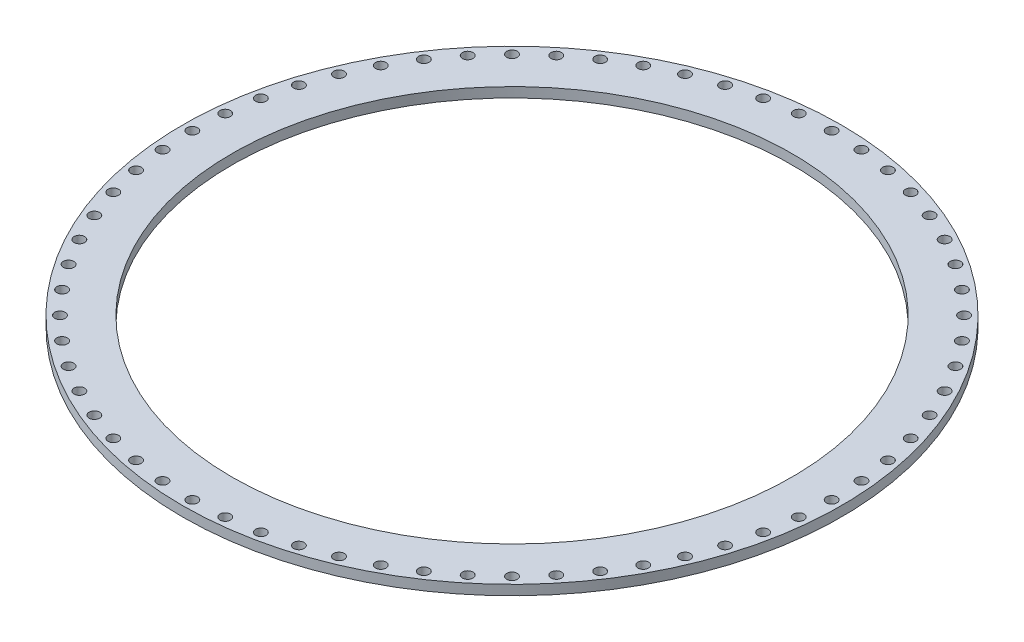
from build123d import *

# Parameters (mm, degrees)
ESQUISSE2_W                  = 100
ESQUISSE2_H                  = 3
ESQUISSE4_R                  = 85
CENTRALHOLE_DEPTH            = 142.453172464
ESQUISSE5_R                  = 1.6
FIXINGHOLE_DEPTH             = 142.453172464
R_P_TITION_CIRCULAIRE1_COUNT = 64


with BuildPart() as part:
    # Esquisse2 → MainRevolution (revolve)
    with BuildSketch(Plane.XY):
        with Locations((50, 1.5)):
            Rectangle(ESQUISSE2_W, ESQUISSE2_H)
    revolve(axis=Axis((0, 55, 0), (0, -1, 0)))

    # Esquisse4 → CentralHole (cut, through all)
    with BuildSketch(Plane(origin=(0, 3, 0), x_dir=(1, 0, 0), z_dir=(0, 1, 0))):
        Circle(ESQUISSE4_R)
    extrude(amount=-CENTRALHOLE_DEPTH, mode=Mode.SUBTRACT)

    # Esquisse5 → FixingHole (cut, through all)
    with BuildSketch(Plane(origin=(0, 3, 0), x_dir=(1, 0, 0), z_dir=(0, 1, 0))):
        with Locations((97, 0)):
            Circle(ESQUISSE5_R)
    fixinghole = extrude(amount=-FIXINGHOLE_DEPTH, mode=Mode.SUBTRACT)

    # Répétition circulaire1: FixingHole ×64 about axis
    r_p_tition_circulaire1_axis = Axis((0, 55, 0), (0, -1, 0))
    for i in range(1, R_P_TITION_CIRCULAIRE1_COUNT):
        add(fixinghole.rotate(r_p_tition_circulaire1_axis, i * 360 / R_P_TITION_CIRCULAIRE1_COUNT), mode=Mode.SUBTRACT)


solid = part.part
